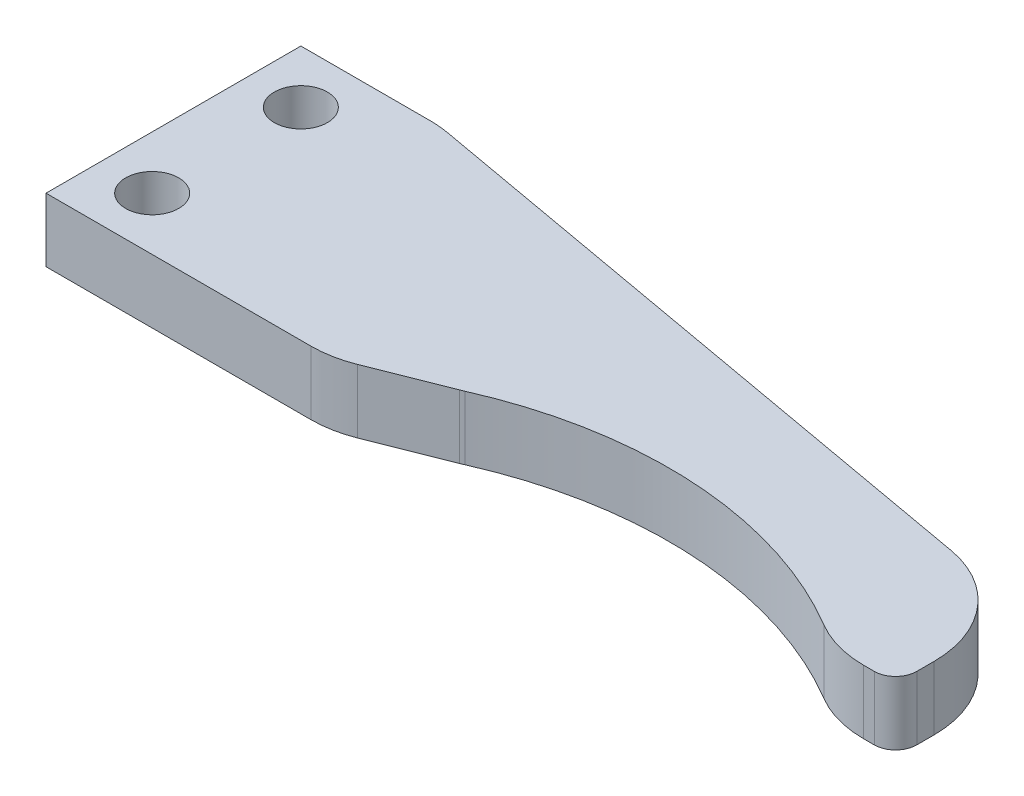
from build123d import *

# Parameters (mm, degrees)
SKETCH1_W           = 40
SKETCH1_H           = 12
BOSS_EXTRUDE1_DEPTH = 3
SKETCH3_R           = 1.25
CUT_EXTRUDE2_DEPTH  = 22.09502311
CUT_EXTRUDE3_DEPTH  = 10
FILLET2_R           = 5
FILLET3_R           = 1
FILLET4_R           = 5
FILLET5_R           = 5


with BuildPart() as part:
    # Sketch1 → Boss-Extrude1 (new body)
    with BuildSketch(Plane(origin=(0, 0, 0), x_dir=(1, 0, 0), z_dir=(0, 1, 0))):
        Rectangle(SKETCH1_W, SKETCH1_H)
    extrude(amount=BOSS_EXTRUDE1_DEPTH)

    # Sketch3 → Cut-Extrude2 (cut, through all)
    with BuildSketch(Plane(origin=(0, 3, 0), x_dir=(1, 0, 0), z_dir=(0, 1, 0))):
        with Locations(Location((-17.5, 3.5, 0), (0, 0, 270))):
            Circle(SKETCH3_R)
        with Locations(Location((-17.5, -3.5, 0), (0, 0, 270))):
            Circle(SKETCH3_R)
    extrude(amount=-CUT_EXTRUDE2_DEPTH, mode=Mode.SUBTRACT)

    # Sketch5 → Cut-Extrude3 (cut)
    with BuildSketch(Plane(origin=(0, 3, 0), x_dir=(1, 0, 0), z_dir=(0, 1, 0))):
        with BuildLine():
            Line((-13.458222524, 6), (20, 0))
            Line((20, 0), (20, -6))
            Line((20, -6), (17.030073052, -6))
            ThreePointArc((17.030073052, -6), (7.671541519, -2.617819669), (-2.144608615, -4.250134828))
            Line((-2.144608615, -4.250134828), (-6.569653649, -6))
            Line((-6.569653649, -6), (-13.458222524, -6))
            Line((-13.458222524, -6), (-13.458222524, -10.237178745))
            Line((-13.458222524, -10.237178745), (26.023482417, -9.726914384))
            Line((26.023482417, -9.726914384), (26.023482417, 8.477274399))
            Line((26.023482417, 8.477274399), (-13.458222524, 8.477274399))
            Line((-13.458222524, 8.477274399), (-13.458222524, 6))
        make_face()
    extrude(amount=-CUT_EXTRUDE3_DEPTH, mode=Mode.SUBTRACT)

    # Fillet2
    # the kernel refuses this fillet: 5 mm, written as the material it takes off along each edge
    with BuildSketch(Plane(origin=(-6.569653649, 5.381801612, 6), x_dir=(-1, 0, 0), z_dir=(0, -1, 0))) as fillet2_piece_1:
        with BuildLine():
            CenterArc((FILLET2_R * 0.190544128998, FILLET2_R), FILLET2_R, 248.423891744, 21.576108256)
            Line((-FILLET2_R * 0.17719268457, FILLET2_R * 0.0700700908417), (0, 0))
            Line((0, 0), (FILLET2_R * 0.190544128998, 0))
        make_face()
    extrude(amount=7.763603225, mode=Mode.SUBTRACT)
    with BuildSketch(Plane(origin=(-2.144608615, 3.259446384, 4.250134828), x_dir=(-0.9299299091583175, 0, 0.36773681356753396), z_dir=(0, -1, 0))) as fillet2_piece_2:
        with BuildLine():
            CenterArc((0.103778554, 5), FILLET2_R, 267.749266862, 2.250733138)
            ThreePointArc((-0.092584454, 0.003857331), (-0.046289955, 0.001983199), (0, 0))
            Line((0, 0), (0.103778554, 0))
        make_face()
    extrude(amount=3.518892769, mode=Mode.SUBTRACT)
    with BuildSketch(Plane(origin=(17.030073052, 6.64587884, 6), x_dir=(1, 0, 0), z_dir=(0, -1, 0))) as fillet2_piece_3:
        with BuildLine():
            CenterArc((1.458351536, -5), FILLET2_R, 90, 30.730822568)
            ThreePointArc((-1.096675494, -0.70211251), (-0.542524687, -0.360136055), (0, 0))
            Line((0, 0), (1.458351536, 0))
        make_face()
    extrude(amount=10.291757681, mode=Mode.SUBTRACT)

    # Fillet3
    fillet3_edges = [part.edges().sort_by_distance(p)[0] for p in [
        (20, 1.5, 6),
    ]]
    fillet(fillet3_edges, radius=FILLET3_R)

    # Fillet4
    fillet4_edges = [part.edges().sort_by_distance(p)[0] for p in [
        (20, 1.5, 0),
    ]]
    fillet(fillet4_edges, radius=FILLET4_R)

    # Fillet5
    fillet5_edges = [part.edges().sort_by_distance(p)[0] for p in [
        (-13.458222524, 1.5, -6),
    ]]
    fillet(fillet5_edges, radius=FILLET5_R)


solid = part.part
